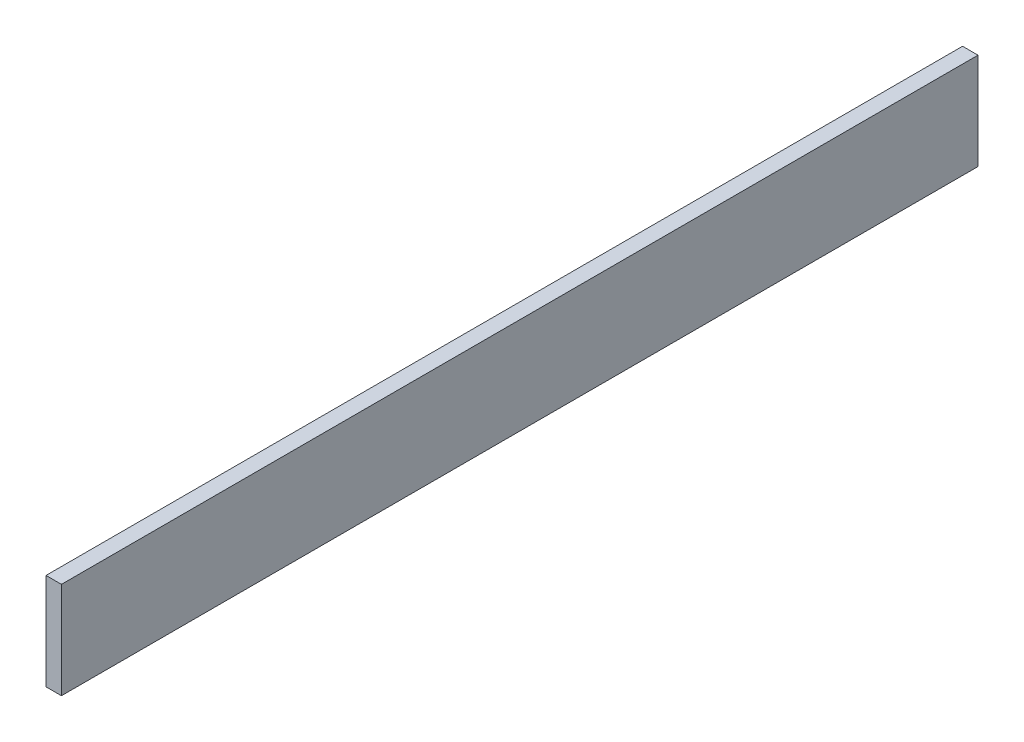
from build123d import *

# Parameters (mm, degrees)
SKETCH1_W           = 190
SKETCH1_H           = 20
BOSS_EXTRUDE1_DEPTH = 3.2


with BuildPart() as part:
    # Sketch1 → Boss-Extrude1 (new body)
    with BuildSketch(Plane(origin=(0, 0, 0), x_dir=(0, 0, -1), z_dir=(1, 0, 0))):
        with Locations((95, 10)):
            Rectangle(SKETCH1_W, SKETCH1_H)
    extrude(amount=BOSS_EXTRUDE1_DEPTH)


solid = part.part
